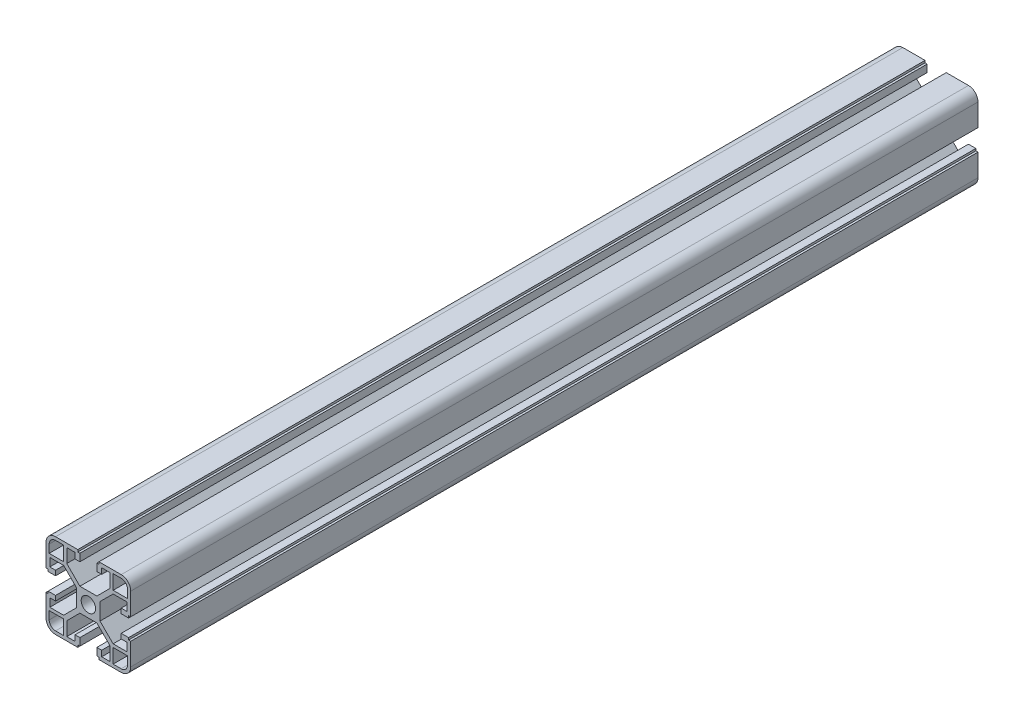
from build123d import *
from build123d.topology import SkipClean

# Parameters (mm, degrees)
BOSS_EXTRUDE1_DEPTH  = 400
MIRROR3_COPY_1_DEPTH = 400
MIRROR3_COPY_2_DEPTH = 400


with BuildPart() as part:
    # Sketch1 → Boss-Extrude1 (new body)
    with BuildSketch(Plane.XY):
        with BuildLine():
            Line((3.4, 0), (5.5, 0))
            Line((5.5, 0), (5.5, 4))
            Line((5.5, 4), (11.69, 10.19))
            Line((11.69, 10.19), (18.2, 10.19))
            Line((18.2, 10.19), (18.2, 6.3))
            Line((18.2, 6.3), (15.5, 6.3))
            Line((15.5, 6.3), (15.5, 4))
            Line((15.5, 4), (19, 4))
            Line((19, 4), (19, 5))
            Line((19, 5), (20, 5))
            Line((20, 5), (20, 15.5))
            ThreePointArc((20, 15.5), (18.681980515, 18.681980515), (15.5, 20))
            Line((15.5, 20), (5, 20))
            Line((5, 20), (5, 19))
            Line((5, 19), (4, 19))
            Line((4, 19), (4, 15.5))
            Line((4, 15.5), (6.3, 15.5))
            Line((6.3, 15.5), (6.3, 18.2))
            Line((6.3, 18.2), (10.19, 18.2))
            Line((10.19, 18.2), (10.19, 11.69))
            Line((10.19, 11.69), (4, 5.5))
            Line((4, 5.5), (0, 5.5))
            Line((0, 5.5), (0, 3.4))
            ThreePointArc((0, 3.4), (2.404163056, 2.404163056), (3.4, 0))
        make_face()
        with BuildLine():
            Line((18.5, 11.69), (18.5, 15.5))
            ThreePointArc((18.5, 15.5), (17.621320344, 17.621320344), (15.5, 18.5))
            Line((15.5, 18.5), (11.69, 18.5))
            Line((11.69, 18.5), (11.69, 11.69))
            Line((11.69, 11.69), (18.5, 11.69))
        make_face(mode=Mode.SUBTRACT)
    boss_extrude1 = extrude(amount=BOSS_EXTRUDE1_DEPTH)

    # Mirror1: Boss-Extrude1 across plane
    add(boss_extrude1.mirror(Plane.ZX))

    # Mirror2: Boss-Extrude1 across plane
    add(boss_extrude1.mirror(Plane(origin=(0, 0, 0), x_dir=(0, 0, 1), z_dir=(1, 0, 0))))

    # Mirror3 copy 1 sketch → Mirror3 copy 1 (add)
    with BuildSketch(Plane(origin=(0, 0, 0), x_dir=(-1, 0, 0), z_dir=(0, 0, 1))):
        with BuildLine():
            Line((3.4, 0), (5.5, 0))
            Line((5.5, 0), (5.5, 4))
            Line((5.5, 4), (11.69, 10.19))
            Line((11.69, 10.19), (18.2, 10.19))
            Line((18.2, 10.19), (18.2, 6.3))
            Line((18.2, 6.3), (15.5, 6.3))
            Line((15.5, 6.3), (15.5, 4))
            Line((15.5, 4), (19, 4))
            Line((19, 4), (19, 5))
            Line((19, 5), (20, 5))
            Line((20, 5), (20, 15.5))
            ThreePointArc((20, 15.5), (18.681980515, 18.681980515), (15.5, 20))
            Line((15.5, 20), (5, 20))
            Line((5, 20), (5, 19))
            Line((5, 19), (4, 19))
            Line((4, 19), (4, 15.5))
            Line((4, 15.5), (6.3, 15.5))
            Line((6.3, 15.5), (6.3, 18.2))
            Line((6.3, 18.2), (10.19, 18.2))
            Line((10.19, 18.2), (10.19, 11.69))
            Line((10.19, 11.69), (4, 5.5))
            Line((4, 5.5), (0, 5.5))
            Line((0, 5.5), (0, 3.4))
            ThreePointArc((0, 3.4), (2.404163056, 2.404163056), (3.4, 0))
        make_face()
        with BuildLine():
            Line((18.5, 11.69), (18.5, 15.5))
            ThreePointArc((18.5, 15.5), (17.621320344, 17.621320344), (15.5, 18.5))
            Line((15.5, 18.5), (11.69, 18.5))
            Line((11.69, 18.5), (11.69, 11.69))
            Line((11.69, 11.69), (18.5, 11.69))
        make_face(mode=Mode.SUBTRACT)
    extrude(amount=MIRROR3_COPY_1_DEPTH)

    # Mirror3 copy 2 sketch → Mirror3 copy 2 (add)
    with SkipClean():  # the faces are left unmerged after this step: merging them gives an invalid solid
        with BuildSketch(Plane.XY):
            with BuildLine():
                Line((3.4, 0), (5.5, 0))
                Line((5.5, 0), (5.5, -4))
                Line((5.5, -4), (11.69, -10.19))
                Line((11.69, -10.19), (18.2, -10.19))
                Line((18.2, -10.19), (18.2, -6.3))
                Line((18.2, -6.3), (15.5, -6.3))
                Line((15.5, -6.3), (15.5, -4))
                Line((15.5, -4), (19, -4))
                Line((19, -4), (19, -5))
                Line((19, -5), (20, -5))
                Line((20, -5), (20, -15.5))
                ThreePointArc((20, -15.5), (18.681980515, -18.681980515), (15.5, -20))
                Line((15.5, -20), (5, -20))
                Line((5, -20), (5, -19))
                Line((5, -19), (4, -19))
                Line((4, -19), (4, -15.5))
                Line((4, -15.5), (6.3, -15.5))
                Line((6.3, -15.5), (6.3, -18.2))
                Line((6.3, -18.2), (10.19, -18.2))
                Line((10.19, -18.2), (10.19, -11.69))
                Line((10.19, -11.69), (4, -5.5))
                Line((4, -5.5), (0, -5.5))
                Line((0, -5.5), (0, -3.4))
                ThreePointArc((0, -3.4), (2.404163056, -2.404163056), (3.4, 0))
            make_face()
            with BuildLine():
                Line((18.5, -11.69), (18.5, -15.5))
                ThreePointArc((18.5, -15.5), (17.621320344, -17.621320344), (15.5, -18.5))
                Line((15.5, -18.5), (11.69, -18.5))
                Line((11.69, -18.5), (11.69, -11.69))
                Line((11.69, -11.69), (18.5, -11.69))
            make_face(mode=Mode.SUBTRACT)
        extrude(amount=MIRROR3_COPY_2_DEPTH)


solid = part.part
